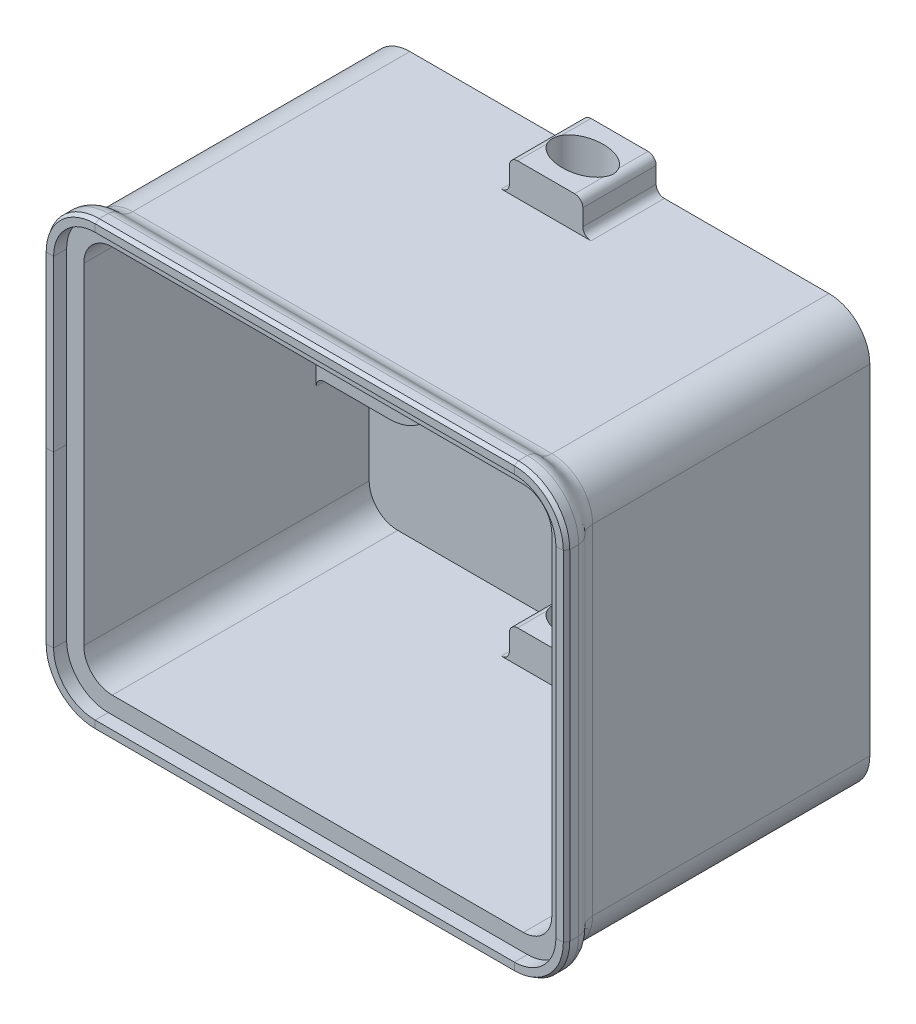
from build123d import *
from OCP.BRepFilletAPI import BRepFilletAPI_MakeChamfer

# Parameters (mm, degrees)
THICKEN2_START       = -2
THICKEN2_OUTLINE_W   = 61.4
THICKEN2_OUTLINE_H   = 51.6
THICKEN2_OUTLINE_W_2 = 57.4
THICKEN2_OUTLINE_H_2 = 47.6
THICKEN2_DEPTH       = 37
THICKEN2_2_OUTLINE_W = 57.4
THICKEN2_2_OUTLINE_H = 47.6
THICKEN2_2_DEPTH     = 2
FILLET1_R            = 5
FILLET2_R            = 3.5
SKETCH3_R            = 2
BOSS_EXTRUDE1_DEPTH  = 6.5
SKETCH5_W            = 9
SKETCH5_H            = 10
BOSS_EXTRUDE2_DEPTH  = 9
CUT_EXTRUDE1_REACH   = 77.628
SKETCH6_RX           = 3.75
SKETCH6_RY           = 2.5
CUT_EXTRUDE2_REACH   = 77.628
SKETCH7_RX           = 3.75
SKETCH7_RY           = 2.5
FILLET3_R            = 1
SKETCH12_R           = 3.7
CUT_EXTRUDE3_DEPTH   = 3
SKETCH13_R           = 2
BOSS_EXTRUDE3_DEPTH  = 0.4
CHAMFER1_SIZE        = 0.5
CHAMFER1_SIZE2       = 0.288675135


# Read off the part's stored shape, not the designer's step: Thicken2
with BuildPart() as part:
    # Thicken2 outline → Thicken2 (new body)
    with BuildSketch(Plane.XY.offset(THICKEN2_START)):
        Rectangle(THICKEN2_OUTLINE_W, THICKEN2_OUTLINE_H)
        Rectangle(THICKEN2_OUTLINE_W_2, THICKEN2_OUTLINE_H_2, mode=Mode.SUBTRACT)
    extrude(amount=THICKEN2_DEPTH)

    # Thicken2 2 outline → Thicken2 2 (add)
    with BuildSketch(Plane.XY.offset(THICKEN2_START)):
        Rectangle(THICKEN2_2_OUTLINE_W, THICKEN2_2_OUTLINE_H)
    extrude(amount=THICKEN2_2_DEPTH)

    # Fillet1
    fillet1_edges = [part.edges().sort_by_distance(p)[0] for p in [
        (30.7, 25.8, 16.5),
        (-30.7, 25.8, 16.5),
        (30.7, -25.8, 16.5),
        (-30.7, -25.8, 16.5),
    ]]
    fillet(fillet1_edges, radius=FILLET1_R)

    # Fillet2
    fillet2_edges = [part.edges().sort_by_distance(p)[0] for p in [
        (28.7, 23.8, 17.5),
        (-28.7, 23.8, 17.5),
        (28.7, -23.8, 17.5),
        (-28.7, -23.8, 17.5),
    ]]
    fillet(fillet2_edges, radius=FILLET2_R)

    # Sketch3 → Boss-Extrude1 (add)
    # profile 1 of 2: a face of its own
    with BuildSketch(Plane.XY):
        with BuildLine():
            Line((-19.75, 6), (-28.7, 6))
            Line((-28.7, 6), (-28.7, -6))
            Line((-28.7, -6), (-19.75, -6))
            ThreePointArc((-19.75, -6), (-13.75, 0), (-19.75, 6))
        make_face()
        with Locations(Location((-19.75, 0, 0), (0, 0, 180))):
            Circle(SKETCH3_R, mode=Mode.SUBTRACT)
    # profile 2 of 2: a face of its own
    with BuildSketch(Plane.XY):
        with BuildLine():
            Line((19.75, 6), (28.7, 6))
            Line((28.7, 6), (28.7, -6))
            Line((28.7, -6), (19.75, -6))
            ThreePointArc((19.75, -6), (13.75, 0), (19.75, 6))
        make_face()
        with Locations(Location((19.75, 0, 0), (0, 0, 180))):
            Circle(SKETCH3_R, mode=Mode.SUBTRACT)
    extrude(amount=BOSS_EXTRUDE1_DEPTH)

    # Sketch5 → Boss-Extrude2 (add)
    with BuildSketch(Plane(origin=(0, 0, -2), x_dir=(-1, 0, 0), z_dir=(0, 0, -1))):
        with Locations((0, 24.8)):
            Rectangle(SKETCH5_W, SKETCH5_H)
        with Locations((0, -24.8)):
            Rectangle(SKETCH5_W, SKETCH5_H)
    extrude(amount=-BOSS_EXTRUDE2_DEPTH)

    # Sketch6 → Cut-Extrude1 (cut, up to next)
    with BuildSketch(Plane.XZ.offset(29.8), mode=Mode.PRIVATE) as cut_extrude1_sk1:
        with Locations(Location((0, 2.5), (0, 0, -180))):
            Ellipse(SKETCH6_RX, SKETCH6_RY)
    cut_extrude1_tool1 = extrude(cut_extrude1_sk1.sketch, amount=-CUT_EXTRUDE1_REACH, mode=Mode.PRIVATE) & part.part
    add(cut_extrude1_tool1.solids().sort_by_distance((0, -29.8, 2.5))[0], mode=Mode.SUBTRACT)

    # Sketch7 → Cut-Extrude2 (cut, up to next)
    with BuildSketch(Plane(origin=(0, 29.8, 0), x_dir=(1, 0, 0), z_dir=(0, 1, 0)), mode=Mode.PRIVATE) as cut_extrude2_sk1:
        with Locations(Location((0, -2.5), (0, 0, -180))):
            Ellipse(SKETCH7_RX, SKETCH7_RY)
    cut_extrude2_tool1 = extrude(cut_extrude2_sk1.sketch, amount=-CUT_EXTRUDE2_REACH, mode=Mode.PRIVATE) & part.part
    add(cut_extrude2_tool1.solids().sort_by_distance((0, 29.8, 2.5))[0], mode=Mode.SUBTRACT)

    # Fillet3
    # the kernel refuses this fillet: 1 mm, written as the material it adds along each edge
    with BuildSketch(Plane(origin=(-28.7, -6, 0), x_dir=(0, -1, 0), z_dir=(0, 0, 1)), Plane(origin=(28.7, 6, 0), x_dir=(0, 1, 0), z_dir=(0, 0, 1))) as fillet3_piece_1:
        with BuildLine():
            CenterArc((FILLET3_R, FILLET3_R), FILLET3_R, 180, 90)
            Line((0, FILLET3_R), (-FILLET3_R * 0.02, FILLET3_R))
            Line((-FILLET3_R * 0.02, FILLET3_R), (-FILLET3_R * 0.02, -FILLET3_R * 0.02))
            Line((-FILLET3_R * 0.02, -FILLET3_R * 0.02), (FILLET3_R, -FILLET3_R * 0.02))
            Line((FILLET3_R, -FILLET3_R * 0.02), (FILLET3_R, 0))
        make_face()
    extrude(amount=6.5)
    with BuildSketch(Plane(origin=(-28.7, 6, 0), x_dir=(0, 1, 0), z_dir=(0, 0, 1)), Plane(origin=(28.7, -6, 0), x_dir=(0, -1, 0), z_dir=(0, 0, 1))) as fillet3_piece_2:
        with BuildLine():
            CenterArc((FILLET3_R, -FILLET3_R), FILLET3_R, 90, 90)
            Line((0, -FILLET3_R), (-FILLET3_R * 0.02, -FILLET3_R))
            Line((-FILLET3_R * 0.02, -FILLET3_R), (-FILLET3_R * 0.02, FILLET3_R * 0.02))
            Line((-FILLET3_R * 0.02, FILLET3_R * 0.02), (FILLET3_R, FILLET3_R * 0.02))
            Line((FILLET3_R, FILLET3_R * 0.02), (FILLET3_R, 0))
        make_face()
    extrude(amount=6.5)
    with BuildSketch(Plane(origin=(4.5, 23.8, 7), x_dir=(1, 0, 0), z_dir=(0, 0, -1)), Plane(origin=(-4.5, 23.8, 0), x_dir=(-1, 0, 0), z_dir=(0, 0, 1)), Plane(origin=(-4.5, -23.8, 7), x_dir=(-1, 0, 0), z_dir=(0, 0, -1)), Plane(origin=(4.5, -23.8, 0), x_dir=(1, 0, 0), z_dir=(0, 0, 1))) as fillet3_piece_3:
        with BuildLine():
            CenterArc((FILLET3_R, FILLET3_R), FILLET3_R, 180, 90)
            Line((0, FILLET3_R), (-FILLET3_R * 0.02, FILLET3_R))
            Line((-FILLET3_R * 0.02, FILLET3_R), (-FILLET3_R * 0.02, -FILLET3_R * 0.02))
            Line((-FILLET3_R * 0.02, -FILLET3_R * 0.02), (FILLET3_R, -FILLET3_R * 0.02))
            Line((FILLET3_R, -FILLET3_R * 0.02), (FILLET3_R, 0))
        make_face()
    extrude(amount=7)
    with BuildSketch(Plane(origin=(4.5, 25.8, -2), x_dir=(1, 0, 0), z_dir=(0, 0, 1)), Plane(origin=(-4.5, 25.8, 7), x_dir=(-1, 0, 0), z_dir=(0, 0, -1)), Plane(origin=(-4.5, -25.8, -2), x_dir=(-1, 0, 0), z_dir=(0, 0, 1)), Plane(origin=(4.5, -25.8, 7), x_dir=(1, 0, 0), z_dir=(0, 0, -1))) as fillet3_piece_4:
        with BuildLine():
            CenterArc((FILLET3_R, FILLET3_R), FILLET3_R, 180, 90)
            Line((0, FILLET3_R), (-FILLET3_R * 0.02, FILLET3_R))
            Line((-FILLET3_R * 0.02, FILLET3_R), (-FILLET3_R * 0.02, -FILLET3_R * 0.02))
            Line((-FILLET3_R * 0.02, -FILLET3_R * 0.02), (FILLET3_R, -FILLET3_R * 0.02))
            Line((FILLET3_R, -FILLET3_R * 0.02), (FILLET3_R, 0))
        make_face()
    extrude(amount=9)
    # the kernel refuses this fillet: 1 mm, written as the material it takes off along each edge
    with BuildSketch(Plane(origin=(4.5, 19.8, 0), x_dir=(-1, 0, 0), z_dir=(0, 0, 1))) as fillet3_2_piece_1:
        with BuildLine():
            CenterArc((FILLET3_R, -FILLET3_R), FILLET3_R, 90, 90)
            Line((0, -FILLET3_R), (-FILLET3_R * 0.02, -FILLET3_R))
            Line((-FILLET3_R * 0.02, -FILLET3_R), (-FILLET3_R * 0.02, FILLET3_R * 0.02))
            Line((-FILLET3_R * 0.02, FILLET3_R * 0.02), (FILLET3_R, FILLET3_R * 0.02))
            Line((FILLET3_R, FILLET3_R * 0.02), (FILLET3_R, 0))
        make_face()
    extrude(amount=7, mode=Mode.SUBTRACT)
    with BuildSketch(Plane(origin=(4.5, 29.8, -2), x_dir=(0, -1, 0), z_dir=(0, 0, 1)), Plane(origin=(-4.5, 29.8, -2), x_dir=(1, 0, 0), z_dir=(0, 0, 1)), Plane(origin=(4.5, -29.8, -2), x_dir=(-1, 0, 0), z_dir=(0, 0, 1))) as fillet3_2_piece_2:
        with BuildLine():
            CenterArc((FILLET3_R, -FILLET3_R), FILLET3_R, 90, 90)
            Line((0, -FILLET3_R), (-FILLET3_R * 0.02, -FILLET3_R))
            Line((-FILLET3_R * 0.02, -FILLET3_R), (-FILLET3_R * 0.02, FILLET3_R * 0.02))
            Line((-FILLET3_R * 0.02, FILLET3_R * 0.02), (FILLET3_R, FILLET3_R * 0.02))
            Line((FILLET3_R, FILLET3_R * 0.02), (FILLET3_R, 0))
        make_face()
    extrude(amount=9, mode=Mode.SUBTRACT)
    with BuildSketch(Plane(origin=(-4.5, 19.8, 0), x_dir=(1, 0, 0), z_dir=(0, 0, 1)), Plane(origin=(-4.5, -19.8, 0), x_dir=(0, -1, 0), z_dir=(0, 0, 1)), Plane(origin=(4.5, -19.8, 0), x_dir=(-1, 0, 0), z_dir=(0, 0, 1))) as fillet3_2_piece_3:
        with BuildLine():
            CenterArc((FILLET3_R, FILLET3_R), FILLET3_R, 180, 90)
            Line((0, FILLET3_R), (-FILLET3_R * 0.02, FILLET3_R))
            Line((-FILLET3_R * 0.02, FILLET3_R), (-FILLET3_R * 0.02, -FILLET3_R * 0.02))
            Line((-FILLET3_R * 0.02, -FILLET3_R * 0.02), (FILLET3_R, -FILLET3_R * 0.02))
            Line((FILLET3_R, -FILLET3_R * 0.02), (FILLET3_R, 0))
        make_face()
    extrude(amount=7, mode=Mode.SUBTRACT)
    with BuildSketch(Plane(origin=(-4.5, -29.8, -2), x_dir=(1, 0, 0), z_dir=(0, 0, 1))) as fillet3_2_piece_4:
        with BuildLine():
            CenterArc((FILLET3_R, FILLET3_R), FILLET3_R, 180, 90)
            Line((0, FILLET3_R), (-FILLET3_R * 0.02, FILLET3_R))
            Line((-FILLET3_R * 0.02, FILLET3_R), (-FILLET3_R * 0.02, -FILLET3_R * 0.02))
            Line((-FILLET3_R * 0.02, -FILLET3_R * 0.02), (FILLET3_R, -FILLET3_R * 0.02))
            Line((FILLET3_R, -FILLET3_R * 0.02), (FILLET3_R, 0))
        make_face()
    extrude(amount=9, mode=Mode.SUBTRACT)

    # Sweep1: sweep along a path in Sketch8
    with BuildLine(Plane.XY.offset(35)) as sweep1_path:
        Line((-25.7, -25.8), (25.7, -25.8))
        ThreePointArc((25.7, -25.8), (29.235533906, -24.335533906), (30.7, -20.8))
        Line((30.7, -20.8), (30.7, 20.8))
        ThreePointArc((30.7, 20.8), (29.235533906, 24.335533906), (25.7, 25.8))
        Line((25.7, 25.8), (-25.7, 25.8))
        ThreePointArc((-25.7, 25.8), (-29.235533906, 24.335533906), (-30.7, 20.8))
        Line((-30.7, 20.8), (-30.7, -20.8))
        ThreePointArc((-30.7, -20.8), (-29.235533906, -24.335533906), (-25.7, -25.8))
    # Sketch9 → Sweep1 (sweep)
    with BuildSketch(Plane(origin=(0, 0, 0), x_dir=(1, 0, 0), z_dir=(0, 1, 0))):
        with BuildLine():
            Line((-30.7, -32), (-30.7, -35))
            Line((-30.7, -35), (-30.8, -35))
            Line((-30.8, -35), (-30.8, -36.6))
            Line((-30.8, -36.6), (-32, -36.6))
            Line((-32, -36.6), (-32, -35))
            add(Edge.make_bspline(
                [(-30.7, -32), (-30.7, -32.33634124), (-30.89241983, -33.277234971), (-31.766256864, -33.898180278), (-32, -34.738135108), (-32, -35)],
                knots=[0, 0, 0, 0, 0.39066515, 0.676130596, 1, 1, 1, 1], degree=3))
        make_face()
    sweep(path=sweep1_path.line)

    # Sketch12 → Cut-Extrude3 (cut)
    with BuildSketch(Plane(origin=(0, 0, -2), x_dir=(-1, 0, 0), z_dir=(0, 0, -1))):
        with Locations((19.75, 0)):
            Circle(SKETCH12_R)
        with Locations((-19.75, 0)):
            Circle(SKETCH12_R)
    extrude(amount=-CUT_EXTRUDE3_DEPTH, mode=Mode.SUBTRACT)

    # Sketch13 → Boss-Extrude3 (add)
    with BuildSketch(Plane(origin=(0, 0, 1), x_dir=(-1, 0, 0), z_dir=(0, 0, -1))):
        with Locations((-19.75, 0)):
            Circle(SKETCH13_R)
        with Locations((19.75, 0)):
            Circle(SKETCH13_R)
    extrude(amount=-BOSS_EXTRUDE3_DEPTH)

    # Chamfer1: one chamfer whose edges measure the first distance from different faces: ONE call of the kernel's chamfer builder (chamfer() names one face for all edges)
    chamfer1_edges_1 = [part.edges().sort_by_distance(p)[0] for p in [
        (-32, 0, 36.6),
        (-32, 0, 36.6),
    ]]
    chamfer1_side_1 = [part.faces().sort_by_distance(p)[0] for p in [
        (-32, 0, 35.8),
    ]]
    chamfer1_edges_2 = [part.edges().sort_by_distance(p)[0] for p in [
        (-30.154772721, -25.254772721, 36.6),
    ]]
    chamfer1_side_2 = [part.faces().sort_by_distance(p)[0] for p in [
        (-30.154772721, -25.254772721, 35.8),
    ]]
    chamfer1_edges_3 = [part.edges().sort_by_distance(p)[0] for p in [
        (0, -27.1, 36.6),
    ]]
    chamfer1_side_3 = [part.faces().sort_by_distance(p)[0] for p in [
        (0, -27.1, 35.8),
    ]]
    chamfer1_edges_4 = [part.edges().sort_by_distance(p)[0] for p in [
        (30.154772721, -25.254772721, 36.6),
    ]]
    chamfer1_side_4 = [part.faces().sort_by_distance(p)[0] for p in [
        (30.154772721, -25.254772721, 35.8),
    ]]
    chamfer1_edges_5 = [part.edges().sort_by_distance(p)[0] for p in [
        (32, 0, 36.6),
    ]]
    chamfer1_side_5 = [part.faces().sort_by_distance(p)[0] for p in [
        (32, 0, 35.8),
    ]]
    chamfer1_edges_6 = [part.edges().sort_by_distance(p)[0] for p in [
        (30.154772721, 25.254772721, 36.6),
    ]]
    chamfer1_side_6 = [part.faces().sort_by_distance(p)[0] for p in [
        (30.154772721, 25.254772721, 35.8),
    ]]
    chamfer1_edges_7 = [part.edges().sort_by_distance(p)[0] for p in [
        (0, 27.1, 36.6),
    ]]
    chamfer1_side_7 = [part.faces().sort_by_distance(p)[0] for p in [
        (0, 27.1, 35.8),
    ]]
    chamfer1_edges_8 = [part.edges().sort_by_distance(p)[0] for p in [
        (-30.154772721, 25.254772721, 36.6),
    ]]
    chamfer1_side_8 = [part.faces().sort_by_distance(p)[0] for p in [
        (-30.154772721, 25.254772721, 35.8),
    ]]
    chamfer1 = BRepFilletAPI_MakeChamfer(part.part.solid().wrapped)
    for e in chamfer1_edges_1:
        chamfer1.Add(CHAMFER1_SIZE, CHAMFER1_SIZE2, e.wrapped, chamfer1_side_1[0].wrapped)  # the first distance lies on this face
    for e in chamfer1_edges_2:
        chamfer1.Add(CHAMFER1_SIZE, CHAMFER1_SIZE2, e.wrapped, chamfer1_side_2[0].wrapped)  # the first distance lies on this face
    for e in chamfer1_edges_3:
        chamfer1.Add(CHAMFER1_SIZE, CHAMFER1_SIZE2, e.wrapped, chamfer1_side_3[0].wrapped)  # the first distance lies on this face
    for e in chamfer1_edges_4:
        chamfer1.Add(CHAMFER1_SIZE, CHAMFER1_SIZE2, e.wrapped, chamfer1_side_4[0].wrapped)  # the first distance lies on this face
    for e in chamfer1_edges_5:
        chamfer1.Add(CHAMFER1_SIZE, CHAMFER1_SIZE2, e.wrapped, chamfer1_side_5[0].wrapped)  # the first distance lies on this face
    for e in chamfer1_edges_6:
        chamfer1.Add(CHAMFER1_SIZE, CHAMFER1_SIZE2, e.wrapped, chamfer1_side_6[0].wrapped)  # the first distance lies on this face
    for e in chamfer1_edges_7:
        chamfer1.Add(CHAMFER1_SIZE, CHAMFER1_SIZE2, e.wrapped, chamfer1_side_7[0].wrapped)  # the first distance lies on this face
    for e in chamfer1_edges_8:
        chamfer1.Add(CHAMFER1_SIZE, CHAMFER1_SIZE2, e.wrapped, chamfer1_side_8[0].wrapped)  # the first distance lies on this face
    add(Compound.cast(chamfer1.Shape()), mode=Mode.REPLACE)


solid = part.part
